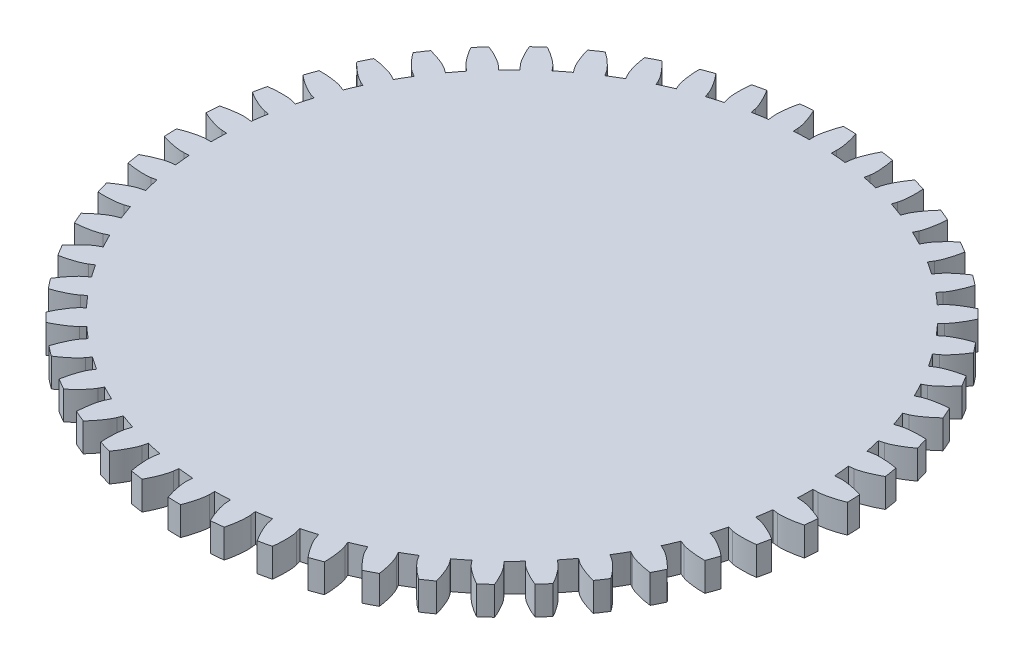
from build123d import *

# Parameters (mm, degrees)
SKETCH1_R           = 73.377777778
BOSS_EXTRUDE1_DEPTH = 3.175
CUT_EXTRUDE2_START  = -3.175
CUT_EXTRUDE2_DEPTH  = 6.35
CIRPATTERN4_COUNT   = 50


# Read off the part's stored shape, not the designer's step: Cut-Extrude2
with BuildPart() as part:
    # Sketch1 → Boss-Extrude1 (new, symmetric)
    with BuildSketch(Plane(origin=(0, 0, 0), x_dir=(1, 0, 0), z_dir=(0, 1, 0))):
        with Locations(Location((0, 0, 0), (0, 0, 270))):
            Circle(SKETCH1_R)
    extrude(amount=BOSS_EXTRUDE1_DEPTH, both=True)

    # Cut-Extrude2 outline → Cut-Extrude2 (cut)
    with BuildSketch(Plane(origin=(0, 0, 0), x_dir=(1, 0, 0), z_dir=(0, 1, 0)).offset(CUT_EXTRUDE2_START)):
        with BuildLine():
            ThreePointArc((73.204321638, -5.04237694), (73.354357684, -1.853774629), (73.365571821, 1.33833592))
            add(Edge.make_bspline(
                [(73.365571821, 1.33833592), (73.345787088, 1.330344118), (73.122144107, 1.240279739), (72.786957847, 1.109916067), (72.337803305, 0.944618458), (71.792872494, 0.759814204), (71.340477166, 0.616825613), (70.885117373, 0.484134118), (70.426573992, 0.362485641), (69.965464336, 0.25322276), (69.539973165, 0.165710142), (69.15168296, 0.098109362), (68.821162534, 0.051372418), (68.564974686, 0.022815163), (68.363599274, 0.007098388), (68.240084353, 0.001038868), (68.174733526, 0), (68.151433299, 0)],
                knots=[0.597130455, 0.597130455, 0.597130455, 0.597130455, 0.597130455, 0.602055883, 0.65278357, 0.680149902, 0.707515959, 0.734882061, 0.762248419, 0.789614739, 0.816980389, 0.844236066, 0.862480775, 0.880559095, 0.894007227, 0.903714166, 0.909090915, 0.909090915, 0.909090915, 0.909090915, 0.909090915], degree=4))
            Line((68.151433299, 0), (67.027777778, 0))
            ThreePointArc((67.027777778, 0), (67.006384423, -1.693351825), (66.942218014, -3.38562271))
            Line((66.942218014, -3.38562271), (68.06443921, -3.442379383))
            add(Edge.make_bspline(
                [(68.06443921, -3.442379383), (68.087709695, -3.443556295), (68.152924628, -3.447894755), (68.275975813, -3.460185371), (68.476300307, -3.486053705), (68.730718689, -3.527514744), (69.058456492, -3.590886862), (69.442836487, -3.678014176), (69.863364199, -3.78690696), (70.318366308, -3.919321359), (70.770179812, -4.06397592), (71.218256001, -4.219498597), (71.662851394, -4.385155489), (72.197752011, -4.597248703), (72.63798391, -4.785022441), (72.966157545, -4.932150212), (73.184965831, -5.033395998), (73.204321638, -5.04237694)],
                knots=[0, 0, 0, 0, 0, 0.005376749, 0.015083688, 0.02853182, 0.04661014, 0.064854849, 0.092110525, 0.119476176, 0.146842496, 0.174208854, 0.201574956, 0.228941013, 0.256307345, 0.307035032, 0.31196046, 0.31196046, 0.31196046, 0.31196046, 0.31196046], degree=4))
        make_face()
    cut_extrude2 = extrude(amount=CUT_EXTRUDE2_DEPTH, mode=Mode.SUBTRACT)

    # CirPattern4: Cut-Extrude2 ×50 about axis
    cirpattern4_axis = Axis((0, 3.175, 0), (0, 1, 0))
    for i in range(1, CIRPATTERN4_COUNT):
        add(cut_extrude2.rotate(cirpattern4_axis, i * 360 / CIRPATTERN4_COUNT), mode=Mode.SUBTRACT)


solid = part.part
